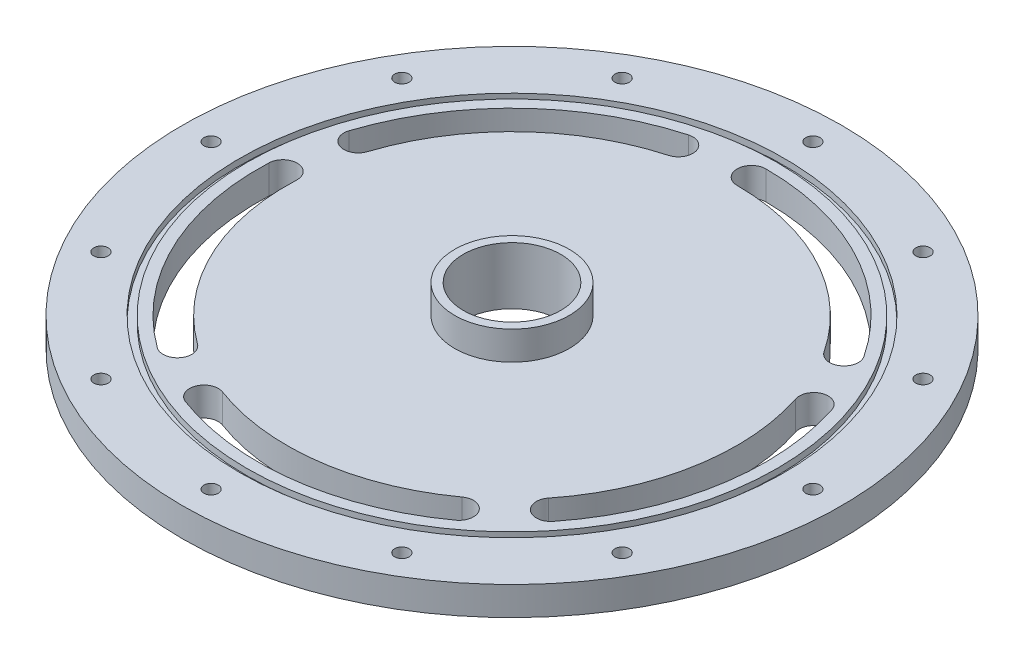
from build123d import *

# Parameters (mm, degrees)
SKETCH1_R           = 146.05
SKETCH1_R_2         = 21.59
SKETCH1_R_3         = 3.175
BOSS_EXTRUDE1_DEPTH = 12.7
SKETCH2_R           = 120.65
SKETCH2_R_2         = 117.475
CUT_EXTRUDE1_DEPTH  = 2.794
CUT_EXTRUDE2_DEPTH  = 207.935968357
SKETCH5_R           = 25.4
SKETCH5_R_2         = 21.59
BOSS_EXTRUDE2_DEPTH = 12.7


with BuildPart() as part:
    # Sketch1 → Boss-Extrude1 (new body)
    with BuildSketch(Plane(origin=(0, 0, 0), x_dir=(1, 0, 0), z_dir=(0, 1, 0))):
        Circle(SKETCH1_R)
        Circle(SKETCH1_R_2, mode=Mode.SUBTRACT)
        with Locations((0, 133.35)):
            Circle(SKETCH1_R_3, mode=Mode.SUBTRACT)
        with Locations((66.675, 115.484487595)):
            Circle(SKETCH1_R_3, mode=Mode.SUBTRACT)
        with Locations((115.484487595, 66.675)):
            Circle(SKETCH1_R_3, mode=Mode.SUBTRACT)
        with Locations((133.35, 0)):
            Circle(SKETCH1_R_3, mode=Mode.SUBTRACT)
        with Locations((115.484487595, -66.675)):
            Circle(SKETCH1_R_3, mode=Mode.SUBTRACT)
        with Locations((66.675, -115.484487595)):
            Circle(SKETCH1_R_3, mode=Mode.SUBTRACT)
        with Locations((0, -133.35)):
            Circle(SKETCH1_R_3, mode=Mode.SUBTRACT)
        with Locations((-66.675, -115.484487595)):
            Circle(SKETCH1_R_3, mode=Mode.SUBTRACT)
        with Locations((-115.484487595, -66.675)):
            Circle(SKETCH1_R_3, mode=Mode.SUBTRACT)
        with Locations((-133.35, 0)):
            Circle(SKETCH1_R_3, mode=Mode.SUBTRACT)
        with Locations((-115.484487595, 66.675)):
            Circle(SKETCH1_R_3, mode=Mode.SUBTRACT)
        with Locations((-66.675, 115.484487595)):
            Circle(SKETCH1_R_3, mode=Mode.SUBTRACT)
    extrude(amount=BOSS_EXTRUDE1_DEPTH)

    # Sketch2 → Cut-Extrude1 (cut)
    with BuildSketch(Plane(origin=(0, 12.7, 0), x_dir=(1, 0, 0), z_dir=(0, 1, 0))):
        Circle(SKETCH2_R)
        Circle(SKETCH2_R_2, mode=Mode.SUBTRACT)
    extrude(amount=-CUT_EXTRUDE1_DEPTH, mode=Mode.SUBTRACT)

    # Sketch3 → Cut-Extrude2 (cut, through all)
    with BuildSketch(Plane(origin=(0, 12.7, 0), x_dir=(1, 0, 0), z_dir=(0, 1, 0))):
        with BuildLine():
            ThreePointArc((93.754850862, 62.219196586), (53.198552827, 99.151976587), (0, 112.522))
            ThreePointArc((0, 112.522), (-6.3754, 106.1466), (0, 99.7712))
            ThreePointArc((0, 99.7712), (47.170184087, 87.916244703), (83.130712006, 55.168623971))
            ThreePointArc((83.130712006, 55.168623971), (91.968067742, 53.38184085), (93.754850862, 62.219196586))
        make_face()
        with BuildLine():
            ThreePointArc((78.157282087, -62.013962994), (98.189705924, -17.693897256), (94.888049899, 30.830996349))
            ThreePointArc((94.888049899, 30.830996349), (98.981308667, 38.864469009), (107.014781327, 34.771210241))
            ThreePointArc((107.014781327, 34.771210241), (110.738390336, -19.955184532), (88.145814573, -69.939372725))
            ThreePointArc((88.145814573, -69.939372725), (79.188843464, -70.970934103), (78.157282087, -62.013962994))
        make_face()
        with BuildLine():
            ThreePointArc((-34.826855208, -93.495360878), (13.514391519, -98.8516746), (58.644039964, -80.716596349))
            ThreePointArc((58.644039964, -80.716596349), (67.549213007, -82.127037198), (66.138772158, -91.032210241))
            ThreePointArc((66.138772158, -91.032210241), (15.24153626, -111.48495888), (-39.27774149, -105.444106082))
            ThreePointArc((-39.27774149, -105.444106082), (-43.026670951, -97.244290339), (-34.826855208, -93.495360878))
        make_face()
        with BuildLine():
            ThreePointArc((-99.681462327, 4.230652181), (-89.837352627, -43.399797492), (-58.644039964, -80.716596349))
            ThreePointArc((-58.644039964, -80.716596349), (-57.233599115, -89.621769393), (-66.138772158, -91.032210241))
            ThreePointArc((-66.138772158, -91.032210241), (-101.318602887, -48.94630929), (-112.420793815, 4.771331253))
            ThreePointArc((-112.420793815, 4.771331253), (-105.780788535, 10.870657462), (-99.681462327, 4.230652181))
        make_face()
        with BuildLine():
            ThreePointArc((-26.779676558, 96.110047721), (-69.036928902, 72.029124645), (-94.888049899, 30.830996349))
            ThreePointArc((-94.888049899, 30.830996349), (-102.921522559, 26.737737581), (-107.014781327, 34.771210241))
            ThreePointArc((-107.014781327, 34.771210241), (-77.859876537, 81.234476115), (-30.20213013, 108.392950968))
            ThreePointArc((-30.20213013, 108.392950968), (-22.34945172, 103.962726131), (-26.779676558, 96.110047721))
        make_face()
    extrude(amount=-CUT_EXTRUDE2_DEPTH, mode=Mode.SUBTRACT)

    # Sketch5 → Boss-Extrude2 (add)
    with BuildSketch(Plane(origin=(0, 12.7, 0), x_dir=(1, 0, 0), z_dir=(0, 1, 0))):
        Circle(SKETCH5_R)
        Circle(SKETCH5_R_2, mode=Mode.SUBTRACT)
    extrude(amount=BOSS_EXTRUDE2_DEPTH)


solid = part.part
